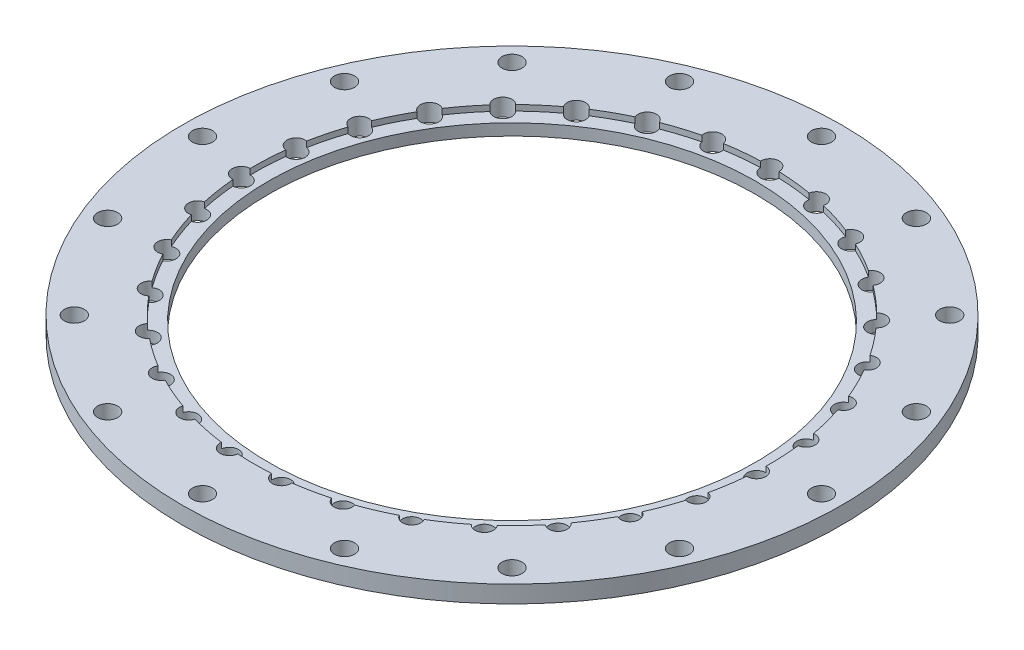
from build123d import *

# Parameters (mm, degrees)
SKETCH1_R                = 57.5
SKETCH1_R_2              = 45
BOSS_EXTRUDE1_DEPTH      = 13
BOSS_EXTRUDE2_START      = 1
SKETCH2_R                = 57.5
SKETCH2_R_2              = 45
BOSS_EXTRUDE2_DEPTH      = 1
BOSS_EXTRUDE3_START      = 2
SKETCH3_R                = 57.5
SKETCH3_R_2              = 42.5
BOSS_EXTRUDE3_DEPTH      = 2
SKETCH5_R                = 3
CUT_EXTRUDE2_DEPTH       = 13
FILLET4_R                = 0.5
SKETCH10_R               = 57.5
SKETCH10_R_2             = 45
BOSS_EXTRUDE4_DEPTH      = 1
SKETCH11_R               = 57.5
SKETCH11_R_2             = 42.5
BOSS_EXTRUDE5_DEPTH      = 2
SKETCH7_R                = 1.6
CUT_EXTRUDE3_DEPTH       = 23
CIRPATTERN3_COUNT        = 31
FILLET4_OF_CIRPATTERN3_R = 0.5
SKETCH4_R                = 1.75
CUT_EXTRUDE1_DEPTH       = 51
SKETCH14_R               = 84.700123292
CUT_EXTRUDE4_DEPTH       = 54


with BuildPart() as part:
    # Sketch1 → Boss-Extrude1 (new body)
    with BuildSketch(Plane(origin=(0, 0, 0), x_dir=(1, 0, 0), z_dir=(0, 1, 0))):
        Circle(SKETCH1_R)
        Circle(SKETCH1_R_2, mode=Mode.SUBTRACT)
    extrude(amount=BOSS_EXTRUDE1_DEPTH)

    # Sketch2 → Boss-Extrude2 (add)
    with BuildSketch(Plane.XZ.offset(BOSS_EXTRUDE2_START)):
        Circle(SKETCH2_R)
        Circle(SKETCH2_R_2, mode=Mode.SUBTRACT)
    extrude(amount=-BOSS_EXTRUDE2_DEPTH)

    # Sketch3 → Boss-Extrude3 (add)
    with BuildSketch(Plane.XZ.offset(1).offset(BOSS_EXTRUDE3_START)):
        Circle(SKETCH3_R)
        Circle(SKETCH3_R_2, mode=Mode.SUBTRACT)
    extrude(amount=-BOSS_EXTRUDE3_DEPTH)

    # Sketch5 → Cut-Extrude2 (cut)
    with BuildSketch(Plane(origin=(0, 13, 0), x_dir=(1, 0, 0), z_dir=(0, 1, 0))):
        with Locations((0, 45)):
            Circle(SKETCH5_R)
    cut_extrude2 = extrude(amount=-CUT_EXTRUDE2_DEPTH, mode=Mode.SUBTRACT)

    # Fillet4
    fillet4_edges = [part.edges().sort_by_distance(p)[0] for p in [
        (2.99833287, 6.5, -44.9),
        (-2.99833287, 6.5, -44.9),
    ]]
    fillet(fillet4_edges, radius=FILLET4_R)

    # Sketch10 → Boss-Extrude4 (add)
    with BuildSketch(Plane(origin=(0, 13, 0), x_dir=(1, 0, 0), z_dir=(0, 1, 0))):
        Circle(SKETCH10_R)
        Circle(SKETCH10_R_2, mode=Mode.SUBTRACT)
    extrude(amount=BOSS_EXTRUDE4_DEPTH)

    # Sketch11 → Boss-Extrude5 (add)
    with BuildSketch(Plane(origin=(0, 14, 0), x_dir=(1, 0, 0), z_dir=(0, 1, 0))):
        Circle(SKETCH11_R)
        Circle(SKETCH11_R_2, mode=Mode.SUBTRACT)
    extrude(amount=BOSS_EXTRUDE5_DEPTH)

    # Sketch7 → Cut-Extrude3 (cut)
    with BuildSketch(Plane(origin=(0, 16, 0), x_dir=(1, 0, 0), z_dir=(0, 1, 0))):
        with Locations((0, 45)):
            Circle(SKETCH7_R)
    cut_extrude3 = extrude(amount=-CUT_EXTRUDE3_DEPTH, mode=Mode.SUBTRACT)

    # CirPattern3: Cut-Extrude2, Cut-Extrude3 ×31 about axis
    cirpattern3_axis = Axis((0, -3, 0), (0, 1, 0))
    add([cut_extrude2.rotate(cirpattern3_axis, i * 360 / CIRPATTERN3_COUNT) for i in range(1, CIRPATTERN3_COUNT)], mode=Mode.SUBTRACT)
    add([cut_extrude3.rotate(cirpattern3_axis, i * 360 / CIRPATTERN3_COUNT) for i in range(1, CIRPATTERN3_COUNT)], mode=Mode.SUBTRACT)

    # Fillet4 of CirPattern3
    fillet4_of_cirpattern3_edges = [part.edges().sort_by_distance(p)[0] for p in [
        (-6.101346732, 6.5, -44.584454332),
        (-11.975260372, 6.5, -43.377334393),
        (-14.951236482, 6.5, -42.443615865),
        (-20.461919307, 6.5, -40.078795619),
        (-23.189020853, 6.5, -38.565130777),
        (-28.110864862, 6.5, -35.139426243),
        (-30.477443987, 6.5, -33.107784704),
        (-34.608948306, 6.5, -28.761444629),
        (-36.518116982, 6.5, -26.295002036),
        (-39.690137341, 6.5, -21.205966091),
        (-41.063733978, 6.5, -18.405698895),
        (-43.146407489, 6.5, -12.782312811),
        (-43.92819688, 6.5, -9.762864278),
        (-44.836258645, 6.5, -3.835350142),
        (-44.99423424, 6.5, -0.720336851),
        (-44.690508104, 6.5, 5.268632212),
        (-44.218202364, 6.5, 8.351681252),
        (-42.715122911, 6.5, 14.156916145),
        (-41.631872087, 6.5, 17.081780543),
        (-38.990975566, 6.5, 22.465614267),
        (-37.341128076, 6.5, 25.112549731),
        (-33.670533101, 6.5, 29.854567501),
        (-31.521633894, 6.5, 32.115208183),
        (-26.971615054, 6.5, 36.021271235),
        (-24.411640317, 6.5, 37.803066239),
        (-19.168475919, 6.5, 40.713259891),
        (-16.302231317, 6.5, 41.943262321),
        (-10.580577126, 6.5, 43.738442904),
        (-7.525407051, 6.5, 44.366296315),
        (-1.559508263, 6.5, 44.972968926),
        (1.559508263, 6.5, 44.972968926),
        (7.525407051, 6.5, 44.366296315),
        (10.580577126, 6.5, 43.738442904),
        (16.302231317, 6.5, 41.943262321),
        (19.168475919, 6.5, 40.713259891),
        (24.411640317, 6.5, 37.803066239),
        (26.971615054, 6.5, 36.021271235),
        (31.521633894, 6.5, 32.115208183),
        (33.670533101, 6.5, 29.854567501),
        (37.341128076, 6.5, 25.112549731),
        (38.990975566, 6.5, 22.465614267),
        (41.631872087, 6.5, 17.081780543),
        (42.715122911, 6.5, 14.156916145),
        (44.218202364, 6.5, 8.351681252),
        (44.690508104, 6.5, 5.268632212),
        (44.99423424, 6.5, -0.720336851),
        (44.836258645, 6.5, -3.835350142),
        (43.92819688, 6.5, -9.762864278),
        (43.146407489, 6.5, -12.782312811),
        (41.063733978, 6.5, -18.405698895),
        (39.690137341, 6.5, -21.205966091),
        (36.518116982, 6.5, -26.295002036),
        (34.608948306, 6.5, -28.761444629),
        (30.477443987, 6.5, -33.107784704),
        (28.110864862, 6.5, -35.139426243),
        (23.189020853, 6.5, -38.565130777),
        (20.461919307, 6.5, -40.078795619),
        (14.951236482, 6.5, -42.443615865),
        (11.975260372, 6.5, -43.377334393),
        (6.101346732, 6.5, -44.584454332),
    ]]
    fillet(fillet4_of_cirpattern3_edges, radius=FILLET4_OF_CIRPATTERN3_R)

    # Sketch4 → Cut-Extrude1 (cut)
    with BuildSketch(Plane(origin=(0, 16, 0), x_dir=(1, 0, 0), z_dir=(0, 1, 0))):
        with Locations((0, 54)):
            Circle(SKETCH4_R)
        with Locations((20.664905348, 49.889494756)):
            Circle(SKETCH4_R)
        with Locations((38.183766184, 38.183766184)):
            Circle(SKETCH4_R)
        with Locations((49.889494756, 20.664905348)):
            Circle(SKETCH4_R)
        with Locations((54, 0)):
            Circle(SKETCH4_R)
        with Locations((49.889494756, -20.664905348)):
            Circle(SKETCH4_R)
        with Locations((38.183766184, -38.183766184)):
            Circle(SKETCH4_R)
        with Locations((20.664905348, -49.889494756)):
            Circle(SKETCH4_R)
        with Locations((0, -54)):
            Circle(SKETCH4_R)
        with Locations((-20.664905348, -49.889494756)):
            Circle(SKETCH4_R)
        with Locations((-38.183766184, -38.183766184)):
            Circle(SKETCH4_R)
        with Locations((-49.889494756, -20.664905348)):
            Circle(SKETCH4_R)
        with Locations((-54, 0)):
            Circle(SKETCH4_R)
        with Locations((-49.889494756, 20.664905348)):
            Circle(SKETCH4_R)
        with Locations((-38.183766184, 38.183766184)):
            Circle(SKETCH4_R)
        with Locations((-20.664905348, 49.889494756)):
            Circle(SKETCH4_R)
    extrude(amount=-CUT_EXTRUDE1_DEPTH, mode=Mode.SUBTRACT)

    # Sketch14 → Cut-Extrude4 (cut)
    with BuildSketch(Plane(origin=(0, 0, 0), x_dir=(1, 0, 0), z_dir=(0, 1, 0))):
        Circle(SKETCH14_R)
    extrude(amount=CUT_EXTRUDE4_DEPTH, mode=Mode.SUBTRACT)


solid = part.part
